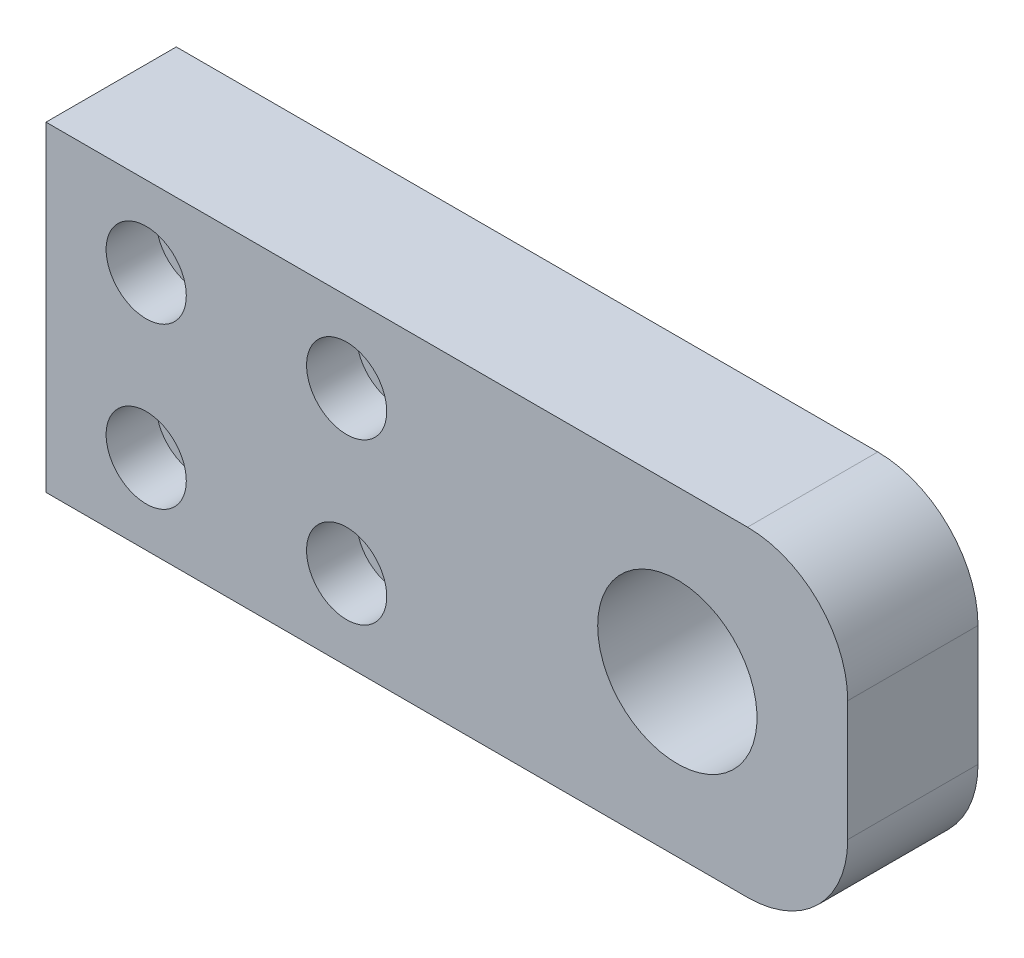
from build123d import *

# Parameters (mm, degrees)
CROQUIS1_W              = 80
CROQUIS1_H              = 32
CROQUIS1_R              = 7.95
SALIENTE_EXTRUIR1_DEPTH = 13
CORTAR_EXTRUIR1_REACH   = 100.453
CROQUIS2_R              = 2.05
CROQUIS3_R              = 4
CORTAR_EXTRUIR2_DEPTH   = 5
REDONDEO1_R             = 10
CROQUIS4_W              = 5
CROQUIS4_H              = 16
SALIENTE_EXTRUIR2_DEPTH = 5
REDONDEO2_R             = 8


with BuildPart() as part:
    # Croquis1 → Saliente-Extruir1 (new body)
    with BuildSketch(Plane.XY):
        with Locations((30, -52)):
            Rectangle(CROQUIS1_W, CROQUIS1_H)
        with Locations(Location((53, -52, 0), (0, 0, 180))):
            Circle(CROQUIS1_R, mode=Mode.SUBTRACT)
    extrude(amount=SALIENTE_EXTRUIR1_DEPTH)

    # Croquis2 → Cortar-Extruir1 (cut, up to next)
    with BuildSketch(Plane.XY.offset(13), mode=Mode.PRIVATE) as cortar_extruir1_sk1:
        with Locations((0, -44)):
            Circle(CROQUIS2_R)
    cortar_extruir1_tool1 = extrude(cortar_extruir1_sk1.sketch, amount=-CORTAR_EXTRUIR1_REACH, mode=Mode.PRIVATE) & part.part
    # Croquis2 → Cortar-Extruir1 (cut, up to next)
    with BuildSketch(Plane.XY.offset(13), mode=Mode.PRIVATE) as cortar_extruir1_sk2:
        with Locations((20, -44)):
            Circle(CROQUIS2_R)
    cortar_extruir1_tool2 = extrude(cortar_extruir1_sk2.sketch, amount=-CORTAR_EXTRUIR1_REACH, mode=Mode.PRIVATE) & part.part
    # Croquis2 → Cortar-Extruir1 (cut, up to next)
    with BuildSketch(Plane.XY.offset(13), mode=Mode.PRIVATE) as cortar_extruir1_sk3:
        with Locations((0, -60)):
            Circle(CROQUIS2_R)
    cortar_extruir1_tool3 = extrude(cortar_extruir1_sk3.sketch, amount=-CORTAR_EXTRUIR1_REACH, mode=Mode.PRIVATE) & part.part
    # Croquis2 → Cortar-Extruir1 (cut, up to next)
    with BuildSketch(Plane.XY.offset(13), mode=Mode.PRIVATE) as cortar_extruir1_sk4:
        with Locations((20, -60)):
            Circle(CROQUIS2_R)
    cortar_extruir1_tool4 = extrude(cortar_extruir1_sk4.sketch, amount=-CORTAR_EXTRUIR1_REACH, mode=Mode.PRIVATE) & part.part
    add(cortar_extruir1_tool1.solids().sort_by_distance((0, -44, 13))[0], mode=Mode.SUBTRACT)
    add(cortar_extruir1_tool2.solids().sort_by_distance((20, -44, 13))[0], mode=Mode.SUBTRACT)
    add(cortar_extruir1_tool3.solids().sort_by_distance((0, -60, 13))[0], mode=Mode.SUBTRACT)
    add(cortar_extruir1_tool4.solids().sort_by_distance((20, -60, 13))[0], mode=Mode.SUBTRACT)

    # Croquis3 → Cortar-Extruir2 (cut)
    with BuildSketch(Plane.XY.offset(13)):
        with Locations((0, -44)):
            Circle(CROQUIS3_R)
        with Locations((20, -44)):
            Circle(CROQUIS3_R)
        with Locations((20, -60)):
            Circle(CROQUIS3_R)
        with Locations((0, -60)):
            Circle(CROQUIS3_R)
    extrude(amount=-CORTAR_EXTRUIR2_DEPTH, mode=Mode.SUBTRACT)

    # Redondeo1
    redondeo1_edges = [part.edges().sort_by_distance(p)[0] for p in [
        (70, -36, 6.5),
        (70, -68, 6.5),
    ]]
    fillet(redondeo1_edges, radius=REDONDEO1_R)

    # Croquis4 → Saliente-Extruir2 (add)
    with BuildSketch(Plane(origin=(0, 0, 0), x_dir=(-1, 0, 0), z_dir=(0, 0, -1))):
        with Locations((-32.5, -52)):
            Rectangle(CROQUIS4_W, CROQUIS4_H)
    extrude(amount=SALIENTE_EXTRUIR2_DEPTH)

    # Redondeo2
    # the kernel refuses this fillet: 8 mm, written as the material it adds along each edge
    with BuildSketch(Plane(origin=(35, -44, 0), x_dir=(1, 0, 0), z_dir=(0, -1, 0))) as redondeo2_piece_1:
        with BuildLine():
            CenterArc((7.416198487, -8), REDONDEO2_R, 90, 67.975687163)
            Line((0, -5), (-0.14832397, -4.94))
            ThreePointArc((-0.14832397, -4.94), (-0.16, -2.5), (-0.16, 0))
            Line((-0.16, 0), (0, 0.16))
            Line((0, 0.16), (7.416198487, 0.16))
            Line((7.416198487, 0.16), (7.416198487, 0))
        make_face()
    extrude(amount=16)


solid = part.part
